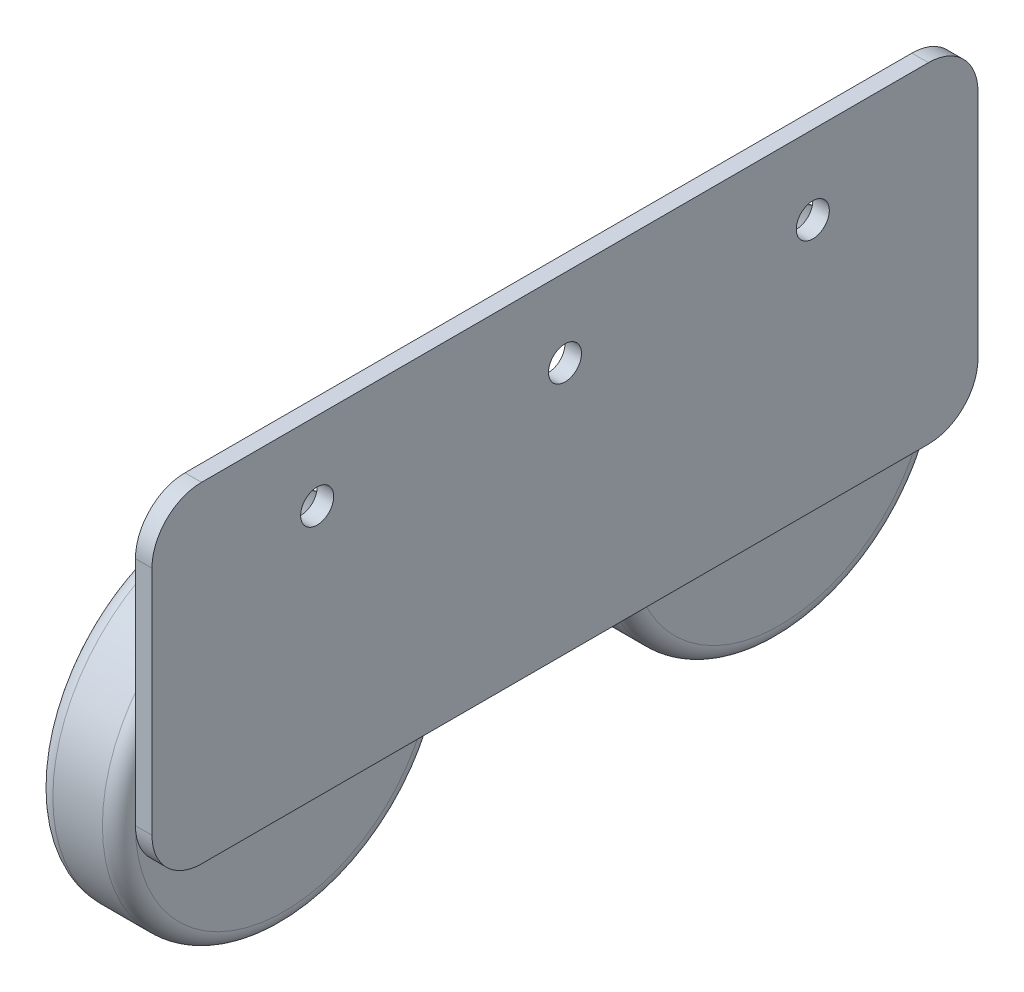
from build123d import *

# Parameters (mm, degrees)
SKETCH1_W               = 1
SKETCH1_H               = 20
BOSS_EXTRUDE1_DEPTH     = 50
SKETCH6_R               = 1
BOSS_EXTRUDE2_DEPTH     = 1
SKETCH7_R               = 10
BOSS_EXTRUDE3_DEPTH     = 5
SKETCH9_R               = 8
SKETCH9_R_2             = 1.5
CUT_EXTRUDE1_DEPTH      = 2
FILLET3_R               = 1
FILLET4_R               = 1
FILLET6_R               = 1
FILLET7_R               = 1
FILLET3_OF_MIRROR2_R    = 1
FILLET4_OF_MIRROR2_R    = 1
FILLET6_OF_MIRROR2_R    = 1
FILLET7_OF_MIRROR2_R    = 1
FILLET8_R               = 3
CUT_EXTRUDE2_DEPTH      = 54.478967862
CUT_EXTRUDE2_DEPTH_BACK = 54.478967862
SKETCH10_R              = 1


with BuildPart() as part:
    # Sketch1 → Boss-Extrude1 (new body)
    with BuildSketch(Plane.XY):
        with Locations((-0.5, 0)):
            Rectangle(SKETCH1_W, SKETCH1_H)
    extrude(amount=BOSS_EXTRUDE1_DEPTH)

    # Sketch6 → Boss-Extrude2 (add)
    with BuildSketch(Plane.ZY.offset(1)):
        with Locations(Location((10, -8, 0), (0, 0, 180))):
            Circle(SKETCH6_R)
    boss_extrude2 = extrude(amount=BOSS_EXTRUDE2_DEPTH)

    # Sketch7 → Boss-Extrude3 (add)
    with BuildSketch(Plane.ZY.offset(2)):
        with Locations((10, -8)):
            Circle(SKETCH7_R)
    boss_extrude3 = extrude(amount=BOSS_EXTRUDE3_DEPTH)

    # Sketch9 → Cut-Extrude1 (cut)
    with BuildSketch(Plane.ZY.offset(7)):
        with Locations((10, -8)):
            Circle(SKETCH9_R)
        with Locations((10, -8)):
            Circle(SKETCH9_R_2, mode=Mode.SUBTRACT)
    cut_extrude1 = extrude(amount=-CUT_EXTRUDE1_DEPTH, mode=Mode.SUBTRACT)

    # Fillet3
    fillet3_edges = [part.edges().sort_by_distance(p)[0] for p in [
        (-7, -8, 8.5),
    ]]
    fillet(fillet3_edges, radius=FILLET3_R)

    # Fillet4
    fillet4_edges = [part.edges().sort_by_distance(p)[0] for p in [
        (-2, -8, 0),
        (-7, -8, 0),
    ]]
    fillet(fillet4_edges, radius=FILLET4_R)

    # Fillet6
    fillet6_edges = [part.edges().sort_by_distance(p)[0] for p in [
        (-7, -8, 2),
    ]]
    fillet(fillet6_edges, radius=FILLET6_R - 0.0001)  # a hair under: the kernel refuses the full size

    # Fillet7
    fillet7_edges = [part.edges().sort_by_distance(p)[0] for p in [
        (-5, -8, 2),
    ]]
    fillet(fillet7_edges, radius=FILLET7_R)

    # Mirror2: Boss-Extrude2, Boss-Extrude3, Cut-Extrude1 across plane
    add(boss_extrude2.mirror(Plane.XY.offset(25)))
    add(boss_extrude3.mirror(Plane.XY.offset(25)))
    add(cut_extrude1.mirror(Plane.XY.offset(25)), mode=Mode.SUBTRACT)

    # Fillet3 of Mirror2
    fillet3_of_mirror2_edges = [part.edges().sort_by_distance(p)[0] for p in [
        (-7, -8, 41.5),
    ]]
    fillet(fillet3_of_mirror2_edges, radius=FILLET3_OF_MIRROR2_R)

    # Fillet4 of Mirror2
    fillet4_of_mirror2_edges = [part.edges().sort_by_distance(p)[0] for p in [
        (-2, -8, 50),
        (-7, -8, 50),
    ]]
    fillet(fillet4_of_mirror2_edges, radius=FILLET4_OF_MIRROR2_R)

    # Fillet6 of Mirror2
    fillet6_of_mirror2_edges = [part.edges().sort_by_distance(p)[0] for p in [
        (-7, -8, 48),
    ]]
    fillet(fillet6_of_mirror2_edges, radius=FILLET6_OF_MIRROR2_R - 0.0001)  # a hair under: the kernel refuses the full size

    # Fillet7 of Mirror2
    fillet7_of_mirror2_edges = [part.edges().sort_by_distance(p)[0] for p in [
        (-5, -8, 48),
    ]]
    fillet(fillet7_of_mirror2_edges, radius=FILLET7_OF_MIRROR2_R)

    # Fillet8
    fillet8_edges = [part.edges().sort_by_distance(p)[0] for p in [
        (-0.5, -10, 50),
        (-0.5, -10, 0),
        (-0.5, 10, 0),
        (-0.5, 10, 50),
    ]]
    fillet(fillet8_edges, radius=FILLET8_R)

    # Sketch10 → Cut-Extrude2 (cut, two sides: drawn at the far end of the back side and taken through both)
    with BuildSketch(Plane.ZY.offset(1).offset(-CUT_EXTRUDE2_DEPTH_BACK)):
        with Locations((10, 5.260914639)):
            Circle(SKETCH10_R)
        with Locations((25, 5.260914639)):
            Circle(SKETCH10_R)
        with Locations(Location((40, 5.260914639, 0), (0, 0, 180))):
            Circle(SKETCH10_R)
    extrude(amount=CUT_EXTRUDE2_DEPTH + CUT_EXTRUDE2_DEPTH_BACK, mode=Mode.SUBTRACT)


solid = part.part
